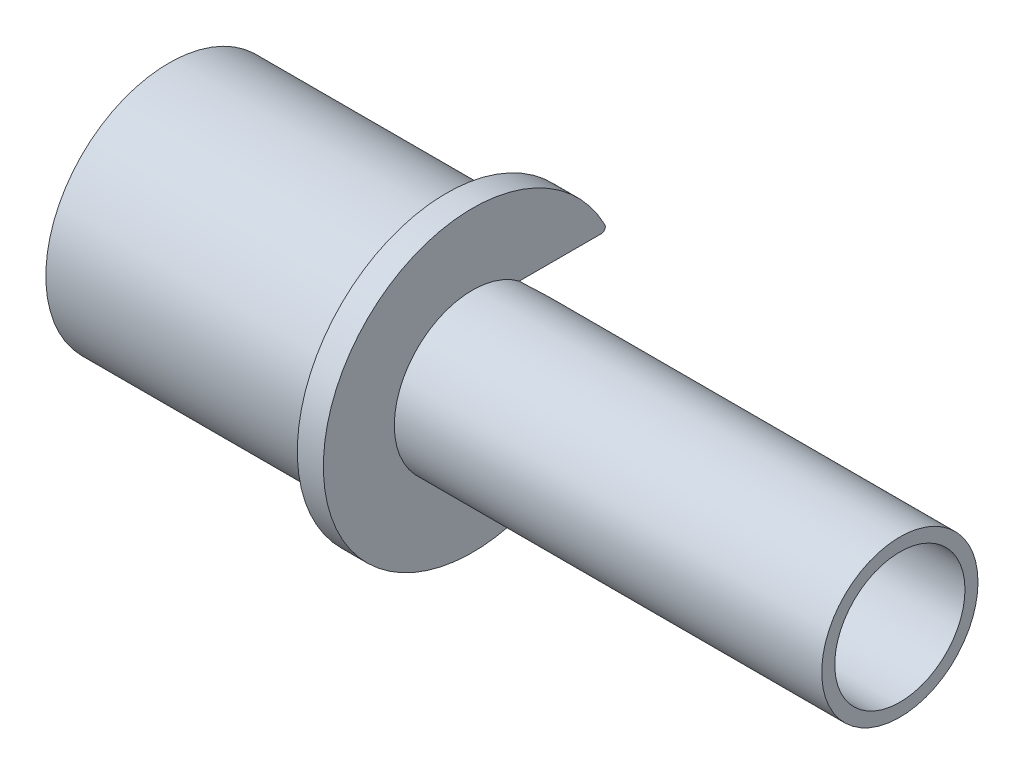
from build123d import *

# Parameters (mm, degrees)
CUT_EXTRUDE2_REACH = 46.224
FILLET1_R          = 0.254


with BuildPart() as part:
    # Sketch1 → Revolve1 (revolve)
    with BuildSketch(Plane.XY):
        Polygon((2.2375, 3.96875), (2.2375, 4.7625), (-23.8125, 4.7625), (-23.8125, 9.087499986), (-25.4, 9.087499986), (-25.4, 7.499999986), (-42.314999952, 7.499999986), (-42.314999952, 3.96875), align=None)
    revolve(axis=Axis((0, 0, 0), (-1, 0, 0)))

    # Sketch3 → Cut-Extrude2 (cut, up to next)
    with BuildSketch(Plane.XY, mode=Mode.PRIVATE) as cut_extrude2_sk1:
        with BuildLine():
            Line((-42.314999952, 3.81), (-42.314999952, -3.81))
            Line((-42.314999952, -3.81), (-23.8125, -3.81))
            ThreePointArc((-23.8125, -3.81), (-21.56743597, -2.88006403), (-20.6375, -0.635))
            Line((-20.6375, -0.635), (-20.6375, 0.635))
            ThreePointArc((-20.6375, 0.635), (-21.56743597, 2.88006403), (-23.8125, 3.81))
            Line((-23.8125, 3.81), (-42.314999952, 3.81))
        make_face()
    cut_extrude2_tool1 = extrude(cut_extrude2_sk1.sketch, amount=-CUT_EXTRUDE2_REACH, mode=Mode.PRIVATE) & part.part
    add(cut_extrude2_tool1.solids().sort_by_distance((-31.748711, 0, 0))[0], mode=Mode.SUBTRACT)

    # Fillet1
    fillet1_edges = [part.edges().sort_by_distance(p)[0] for p in [
        (-24.60625, 3.81, -8.250245814),
        (-24.60625, -3.81, -8.250245814),
        (-33.857499976, -3.81, -6.460178),
        (-33.857499976, 3.81, -6.460178),
    ]]
    fillet(fillet1_edges, radius=FILLET1_R)


solid = part.part
